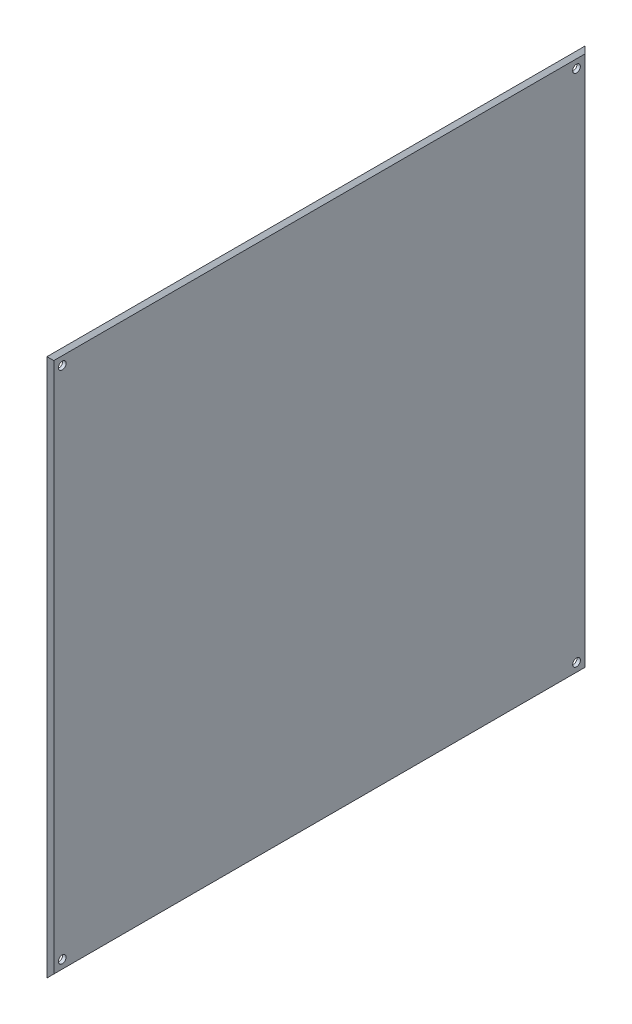
from build123d import *

# Parameters (mm, degrees)
SKETCH1_W                = 316
SKETCH1_H                = 316
BOSS_EXTRUDE1_DEPTH      = 2
CHAMFER1_SIZE            = 2
M4_CLEARANCE_HOLE1_D     = 4.5
M4_CLEARANCE_HOLE1_DEPTH = 30
M4_CLEARANCE_HOLE1_TIP   = 1.351936393


with BuildPart() as part:
    # Sketch1 → Boss-Extrude1 (new body)
    with BuildSketch(Plane(origin=(0, 0, 0), x_dir=(0, 0, -1), z_dir=(1, 0, 0))):
        with Locations((158, 158)):
            Rectangle(SKETCH1_W, SKETCH1_H)
    extrude(amount=BOSS_EXTRUDE1_DEPTH)

    # Chamfer1
    chamfer1_edges = [part.edges().sort_by_distance(p)[0] for p in [
        (2, 158, 0),
        (2, 316, -158),
        (2, 158, -316),
        (2, 0, -158),
    ]]
    chamfer(chamfer1_edges, length=CHAMFER1_SIZE - 0.0001)  # a hair under: the kernel refuses the full size

    # M4 Clearance Hole1
    with Locations(Plane(origin=(2, 0, 0), x_dir=(0, 0, -1), z_dir=(1, 0, 0))):
        with Locations((7, 309), (309, 309), (309, 7), (7, 7)):
            Hole(M4_CLEARANCE_HOLE1_D / 2, depth=M4_CLEARANCE_HOLE1_DEPTH)
            with Locations((0, 0, -(M4_CLEARANCE_HOLE1_DEPTH + M4_CLEARANCE_HOLE1_TIP / 2))):  # 118° drill point
                Cone(0, M4_CLEARANCE_HOLE1_D / 2, M4_CLEARANCE_HOLE1_TIP, mode=Mode.SUBTRACT)


solid = part.part
